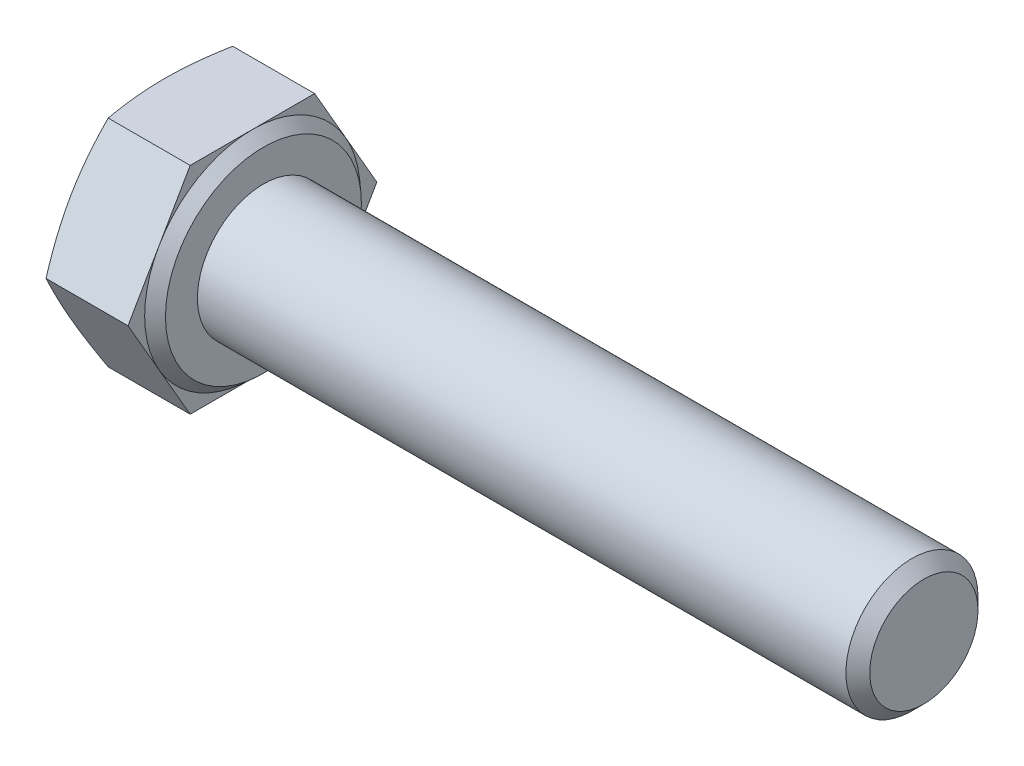
from build123d import *

# Parameters (mm, degrees)
BASEHEAD_DEPTH = 4
SKETCH3_R      = 3
BASEBODY_DEPTH = 30
CHAMFER1_SIZE  = 0.5415


with BuildPart() as part:
    # Sketch-BaseHead → BaseHead (new body)
    with BuildSketch(Plane(origin=(0, 0, 0), x_dir=(0, 0, -1), z_dir=(1, 0, 0))):
        Polygon((5.652259135, 0), (2.826129568, 4.895), (-2.826129568, 4.895), (-5.652259135, 0), (-2.826129568, -4.895), (2.826129568, -4.895), align=None)
    extrude(amount=BASEHEAD_DEPTH)

    # Sketch4 → HeadChamfer (revolve, cut)
    with BuildSketch(Plane(origin=(-0.264637255, 0, 5.916896391), x_dir=(0, 0, -1), z_dir=(0, 1, 0))):
        Polygon((11.569155526, -0.264637255), (10.811896391, -0.264637255), (11.569155526, -0.54025704), align=None)
    revolve(axis=Axis((-4.001564945, 0, 0), (1, 0, 0)), mode=Mode.SUBTRACT)

    # Sketch1 → Revolve1 (revolve)
    with BuildSketch(Plane.XY):
        Polygon((4, 0), (4.5, 0), (4.5, -4.45), (4, -4.895), align=None)
    revolve(axis=Axis((-4.001564945, 0, 0), (1, 0, 0)))

    # Sketch3 → BaseBody (add)
    with BuildSketch(Plane(origin=(4.5, 0, 0), x_dir=(0, 0, -1), z_dir=(1, 0, 0))):
        Circle(SKETCH3_R)
    extrude(amount=BASEBODY_DEPTH)

    # Chamfer1
    chamfer1_edges = [part.edges().sort_by_distance(p)[0] for p in [
        (34.5, 0, 3),
    ]]
    chamfer(chamfer1_edges, length=CHAMFER1_SIZE)


solid = part.part
